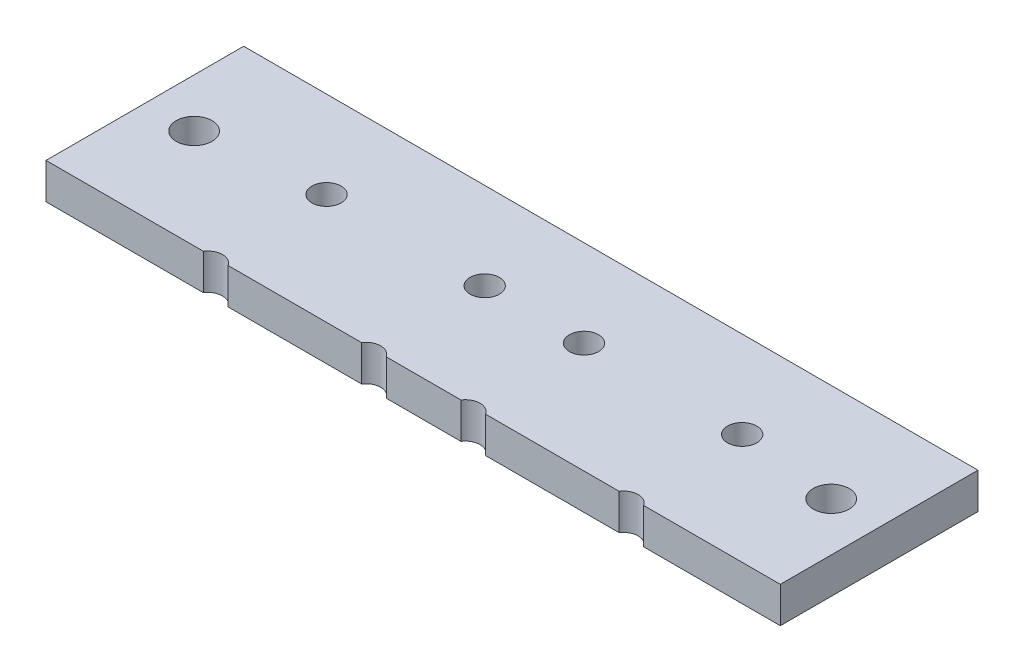
from build123d import *

# Parameters (mm, degrees)
SKETCH1_W           = 130
SKETCH1_H           = 35
BOSS_EXTRUDE1_DEPTH = 6.35
SKETCH5_R           = 3.18
CUT_EXTRUDE2_DEPTH  = 135.778790987
SKETCH8_R           = 2.58660254
CUT_EXTRUDE4_DEPTH  = 135.778790987


with BuildPart() as part:
    # Sketch1 → Boss-Extrude1 (new body)
    with BuildSketch(Plane(origin=(0, 0, 0), x_dir=(1, 0, 0), z_dir=(0, 1, 0))):
        with Locations((65, -17.5)):
            Rectangle(SKETCH1_W, SKETCH1_H)
    extrude(amount=BOSS_EXTRUDE1_DEPTH)

    # Sketch5 → Cut-Extrude2 (cut, through all)
    with BuildSketch(Plane(origin=(0, 6.35, 0), x_dir=(1, 0, 0), z_dir=(0, 1, 0))):
        with Locations((8.605, -17.382603272)):
            Circle(SKETCH5_R)
        with Locations((121.395, -17.382603272)):
            Circle(SKETCH5_R)
    extrude(amount=-CUT_EXTRUDE2_DEPTH, mode=Mode.SUBTRACT)

    # Sketch8 → Cut-Extrude4 (cut, through all)
    with BuildSketch(Plane.XZ):
        with Locations((30.060178316, 15.39650076)):
            Circle(SKETCH8_R)
        with Locations((30.060178316, 36.39650076)):
            Circle(SKETCH8_R)
        with Locations((58.060178316, 36.39650076)):
            Circle(SKETCH8_R)
        with Locations((58.060178316, 15.39650076)):
            Circle(SKETCH8_R)
        with Locations((75.642130445, 15.396500763)):
            Circle(SKETCH8_R)
        with Locations((75.642130445, 36.396500763)):
            Circle(SKETCH8_R)
        with Locations((103.642130445, 15.396500763)):
            Circle(SKETCH8_R)
        with Locations((103.642130445, 36.396500763)):
            Circle(SKETCH8_R)
    extrude(amount=-CUT_EXTRUDE4_DEPTH, mode=Mode.SUBTRACT)


solid = part.part
